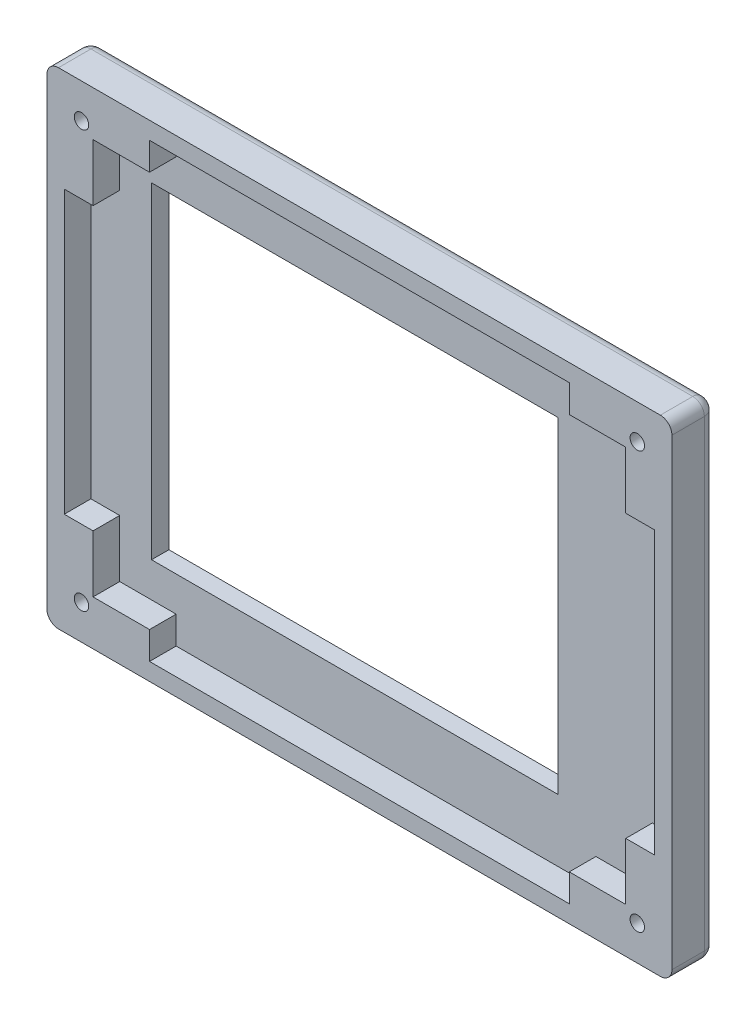
from build123d import *

# Parameters (mm, degrees)
SKETCH_2_W          = 53.974572009
SKETCH_2_H          = 41.974503429
EXTRUDE_1_DEPTH     = 3.8
CUT_EXTRUDE_1_DEPTH = 2.3
SKETCH_4_W          = 46
SKETCH_4_H          = 34.2
CUT_EXTRUDE_2_DEPTH = 2.3
SKETCH_5_R          = 0.625
CUT_EXTRUDE_3_DEPTH = 2.8
SKETCH_7_W          = 35.12
SKETCH_7_H          = 28.19
CUT_EXTRUDE_4_DEPTH = 1.5
SKETCH_8_W          = 3
SKETCH_8_H          = 2.387251715
SKETCH_8_W_2        = 2.487286004
SKETCH_8_H_2        = 3
SKETCH_8_W_3        = 2.487286005
SKETCH_8_W_4        = 3.00002286
SKETCH_8_H_3        = 2.387274574
SKETCH_8_W_5        = 2.999984296
EXTRUDE_2_DEPTH     = 2.3
FILLET_1_R          = 1


with BuildPart() as part:
    # 草图2 → 凸台-拉伸1 (new body)
    with BuildSketch(Plane.XY):
        with Locations((-20.223936838, 24.775730738)):
            Rectangle(SKETCH_2_W, SKETCH_2_H)
    extrude(amount=EXTRUDE_1_DEPTH)

    # 草图3 → 切除-拉伸1 (cut)
    with BuildSketch(Plane.XY.offset(3.8)):
        with BuildLine():
            Line((0.763318687, 42.775657077), (0.763318687, 44.262982452))
            Line((0.763318687, 44.262982452), (-41.211192362, 44.262982452))
            Line((-41.211192362, 44.262982452), (-41.211192362, 42.775679937))
            ThreePointArc((-41.211192362, 42.775679937), (-42.093593258, 40.645375728), (-44.223897468, 39.762974832))
            Line((-44.223897468, 39.762974832), (-45.711222842, 39.762974832))
            Line((-45.711222842, 39.762974832), (-45.711222842, 9.788486643))
            Line((-45.711222842, 9.788486643), (-44.223920328, 9.788486643))
            ThreePointArc((-44.223920328, 9.788486643), (-42.093616118, 8.906085747), (-41.211215222, 6.775781538))
            Line((-41.211215222, 6.775781538), (-41.211215222, 5.288456163))
            Line((-41.211215222, 5.288456163), (0.763295827, 5.288456163))
            Line((0.763295827, 5.288456163), (0.763295827, 6.775758677))
            ThreePointArc((0.763295827, 6.775758677), (1.645696722, 8.906062887), (3.776000932, 9.788463783))
            Line((3.776000932, 9.788463783), (5.263303447, 9.788463783))
            Line((5.263303447, 9.788463783), (5.263326307, 39.762951972))
            Line((5.263326307, 39.762951972), (3.776023792, 39.762951972))
            ThreePointArc((3.776023792, 39.762951972), (1.645719582, 40.645352868), (0.763318687, 42.775657077))
        make_face()
    extrude(amount=-CUT_EXTRUDE_1_DEPTH, mode=Mode.SUBTRACT)

    # 草图4 → 切除-拉伸2 (cut)
    with BuildSketch(Plane.XY.offset(3.8)):
        with Locations((-20.223936838, 24.775730737)):
            Rectangle(SKETCH_4_W, SKETCH_4_H)
    extrude(amount=-CUT_EXTRUDE_2_DEPTH, mode=Mode.SUBTRACT)

    # 草图5 → 切除-拉伸3 (cut)
    with BuildSketch(Plane.XY.offset(3.8)):
        with Locations((-44.223897468, 42.775679937)):
            Circle(SKETCH_5_R)
        with Locations((3.776023792, 42.775679937)):
            Circle(SKETCH_5_R)
        with Locations((3.776023792, 6.775781538)):
            Circle(SKETCH_5_R)
        with Locations((-44.223897468, 6.775781538)):
            Circle(SKETCH_5_R)
    extrude(amount=-CUT_EXTRUDE_3_DEPTH, mode=Mode.SUBTRACT)

    # 草图7 → 切除-拉伸4 (cut)
    with BuildSketch(Plane(origin=(0, 0, 0), x_dir=(-1, 0, 0), z_dir=(0, 0, -1))):
        with Locations((22.913936838, 24.775730737)):
            Rectangle(SKETCH_7_W, SKETCH_7_H)
    extrude(amount=-CUT_EXTRUDE_4_DEPTH, mode=Mode.SUBTRACT)


with BuildPart() as extrude_2_tool:
    # 草图8 → 凸台-拉伸2 (new body)
    with BuildSketch(Plane.XY.offset(1.5)):
        with Locations((-39.848748169, 43.069356595)):
            Rectangle(SKETCH_8_W, SKETCH_8_H)
        with Locations((-44.46757984, 38.43376671)):
            Rectangle(SKETCH_8_W_2, SKETCH_8_H_2)
        with Locations((4.019706165, 38.43376671)):
            Rectangle(SKETCH_8_W_3, SKETCH_8_H_2)
        with Locations((-0.599125507, 43.069356595)):
            Rectangle(SKETCH_8_W, SKETCH_8_H)
        with Locations((4.019706165, 11.117694765)):
            Rectangle(SKETCH_8_W_3, SKETCH_8_H_2)
        with Locations((-44.46757984, 11.117694765)):
            Rectangle(SKETCH_8_W_2, SKETCH_8_H_2)
        with Locations((-39.848759599, 6.48209345)):
            Rectangle(SKETCH_8_W_4, SKETCH_8_H_3)
        with Locations((-0.599133359, 6.48209345)):
            Rectangle(SKETCH_8_W_5, SKETCH_8_H_3)
    extrude(amount=EXTRUDE_2_DEPTH)


with BuildPart() as part_1:
    add(part.part)


with BuildPart() as part_2:
    # 凸台-拉伸2: joined with extrude_2_tool
    add(part_1.part.fuse(extrude_2_tool.part, tol=0.00001))

    # 圆角1
    fillet_1_edges = [part_2.edges().sort_by_distance(p)[0] for p in [
        (-20.223936838, 45.762982452, 0),
        (6.763349167, 24.775730737, 0),
        (-20.223936838, 3.788479023, 0),
        (-47.211222842, 24.775730737, 0),
        (-47.211222842, 45.762982452, 1.9),
        (6.763349167, 45.762982452, 1.9),
        (6.763349167, 3.788479023, 1.9),
        (-47.211222842, 3.788479023, 1.9),
    ]]
    fillet(fillet_1_edges, radius=FILLET_1_R)


solid = part_2.part
